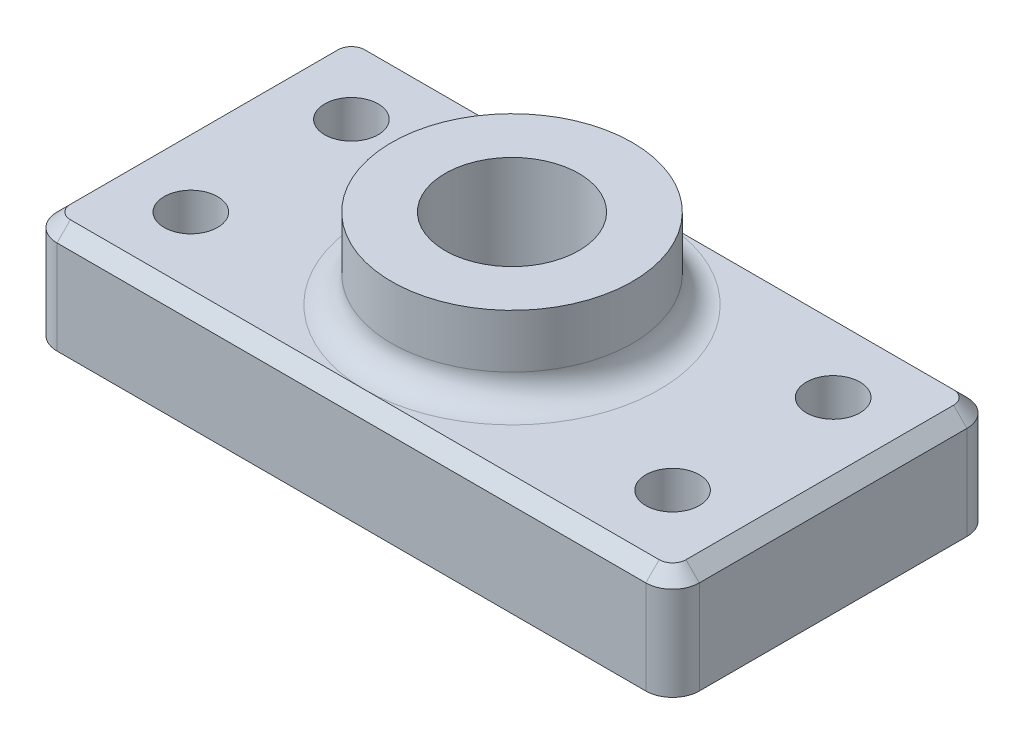
from build123d import *

# Parameters (mm, degrees)
SKETCH1_W           = 152.4
SKETCH1_H           = 76.2
BOSS_EXTRUDE1_DEPTH = 25.4
FILLET1_R           = 6.35
CHAMFER1_SIZE       = 3.175
SKETCH2_R           = 28.575
BOSS_EXTRUDE2_DEPTH = 19.05
SKETCH3_R           = 15.875
CUT_EXTRUDE1_DEPTH  = 177.090892723
FILLET2_R           = 6.35
SKETCH4_R           = 6.35
CUT_EXTRUDE2_DEPTH  = 173.271181571


with BuildPart() as part:
    # Sketch1 → Boss-Extrude1 (new body)
    with BuildSketch(Plane(origin=(0, 0, 0), x_dir=(1, 0, 0), z_dir=(0, 1, 0))):
        with Locations((76.2, 38.1)):
            Rectangle(SKETCH1_W, SKETCH1_H)
    extrude(amount=BOSS_EXTRUDE1_DEPTH)

    # Fillet1
    fillet1_edges = [part.edges().sort_by_distance(p)[0] for p in [
        (0, 12.7, -76.2),
        (152.4, 12.7, -76.2),
        (152.4, 12.7, 0),
        (0, 12.7, 0),
    ]]
    fillet(fillet1_edges, radius=FILLET1_R)

    # Chamfer1
    chamfer1_edges = [part.edges().sort_by_distance(p)[0] for p in [
        (0, 25.4, -38.1),
        (1.859871939, 25.4, -1.859871939),
        (1.859871939, 25.4, -74.340128061),
        (76.2, 25.4, 0),
        (76.2, 25.4, -76.2),
        (150.540128061, 25.4, -1.859871939),
        (150.540128061, 25.4, -74.340128061),
        (152.4, 25.4, -38.1),
    ]]
    chamfer(chamfer1_edges, length=CHAMFER1_SIZE)

    # Sketch2 → Boss-Extrude2 (add)
    with BuildSketch(Plane(origin=(0, 25.4, 0), x_dir=(1, 0, 0), z_dir=(0, 1, 0))):
        with Locations((76.2, 38.1)):
            Circle(SKETCH2_R)
    extrude(amount=BOSS_EXTRUDE2_DEPTH)

    # Sketch3 → Cut-Extrude1 (cut, through all)
    with BuildSketch(Plane(origin=(0, 44.45, 0), x_dir=(1, 0, 0), z_dir=(0, 1, 0))):
        with Locations((76.2, 38.1)):
            Circle(SKETCH3_R)
    extrude(amount=-CUT_EXTRUDE1_DEPTH, mode=Mode.SUBTRACT)

    # Fillet2
    fillet2_edges = [part.edges().sort_by_distance(p)[0] for p in [
        (47.625, 25.4, -38.1),
    ]]
    fillet(fillet2_edges, radius=FILLET2_R)

    # Sketch4 → Cut-Extrude2 (cut, through all)
    with BuildSketch(Plane(origin=(0, 25.4, 0), x_dir=(1, 0, 0), z_dir=(0, 1, 0))):
        with Locations((133.35, 19.05)):
            Circle(SKETCH4_R)
        with Locations((133.35, 57.15)):
            Circle(SKETCH4_R)
        with Locations((19.05, 57.15)):
            Circle(SKETCH4_R)
        with Locations((19.05, 19.05)):
            Circle(SKETCH4_R)
    extrude(amount=-CUT_EXTRUDE2_DEPTH, mode=Mode.SUBTRACT)


solid = part.part
